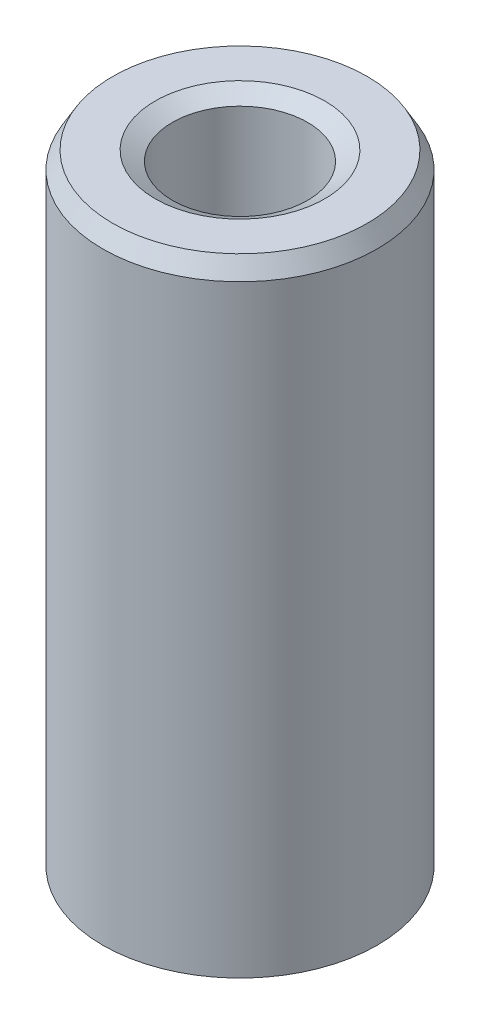
from build123d import *
from OCP.BRepFilletAPI import BRepFilletAPI_MakeChamfer

# Parameters (mm, degrees)
SKETCH1_R           = 22.5
BOSS_EXTRUDE1_DEPTH = 103.341447079
SKETCH2_R           = 11.087212619
CUT_EXTRUDE1_DEPTH  = 109.129342384
CHAMFER1_SIZE       = 2.820856346
CHAMFER1_SIZE2      = 1.628622171


with BuildPart() as part:
    # Sketch1 → Boss-Extrude1 (new body)
    with BuildSketch(Plane(origin=(0, 0, 0), x_dir=(1, 0, 0), z_dir=(0, 1, 0))):
        Circle(SKETCH1_R)
    extrude(amount=BOSS_EXTRUDE1_DEPTH)

    # Sketch2 → Cut-Extrude1 (cut, through all)
    with BuildSketch(Plane(origin=(0, 0, 0), x_dir=(1, 0, 0), z_dir=(0, 1, 0))):
        Circle(SKETCH2_R)
    extrude(amount=CUT_EXTRUDE1_DEPTH, mode=Mode.SUBTRACT)

    # Chamfer1: one chamfer whose edges measure the first distance from different faces: ONE call of the kernel's chamfer builder (chamfer() names one face for all edges)
    chamfer1_edges_1 = [part.edges().sort_by_distance(p)[0] for p in [
        (-11.087212619, 103.341447079, 0),
    ]]
    chamfer1_side_1 = [part.faces().sort_by_distance(p)[0] for p in [
        (-21.863603897, 103.341447079, 0),
    ]]
    chamfer1_edges_2 = [part.edges().sort_by_distance(p)[0] for p in [
        (-11.087212619, 0, 0),
    ]]
    chamfer1_side_2 = [part.faces().sort_by_distance(p)[0] for p in [
        (-11.087212619, 51.67072354, 0),
    ]]
    chamfer1_edges_3 = [part.edges().sort_by_distance(p)[0] for p in [
        (-22.5, 0, 0),
    ]]
    chamfer1_side_3 = [part.faces().sort_by_distance(p)[0] for p in [
        (-21.863603897, 0, 0),
    ]]
    chamfer1_edges_4 = [part.edges().sort_by_distance(p)[0] for p in [
        (-22.5, 103.341447079, 0),
    ]]
    chamfer1_side_4 = [part.faces().sort_by_distance(p)[0] for p in [
        (-22.5, 51.67072354, 0),
    ]]
    chamfer1 = BRepFilletAPI_MakeChamfer(part.part.solid().wrapped)
    for e in chamfer1_edges_1:
        chamfer1.Add(CHAMFER1_SIZE, CHAMFER1_SIZE2, e.wrapped, chamfer1_side_1[0].wrapped)  # the first distance lies on this face
    for e in chamfer1_edges_2:
        chamfer1.Add(CHAMFER1_SIZE, CHAMFER1_SIZE2, e.wrapped, chamfer1_side_2[0].wrapped)  # the first distance lies on this face
    for e in chamfer1_edges_3:
        chamfer1.Add(CHAMFER1_SIZE, CHAMFER1_SIZE2, e.wrapped, chamfer1_side_3[0].wrapped)  # the first distance lies on this face
    for e in chamfer1_edges_4:
        chamfer1.Add(CHAMFER1_SIZE, CHAMFER1_SIZE2, e.wrapped, chamfer1_side_4[0].wrapped)  # the first distance lies on this face
    add(Compound.cast(chamfer1.Shape()), mode=Mode.REPLACE)


solid = part.part
